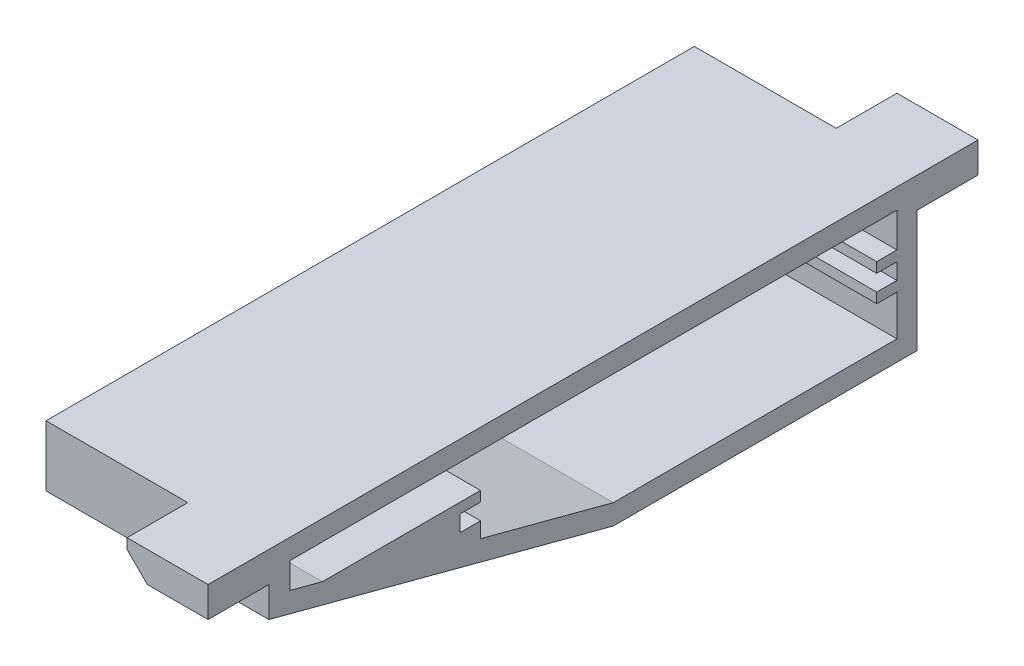
from build123d import *

# Parameters (mm, degrees)
SKETCH_1_W      = 22
SKETCH_1_H      = 15
EXTRUDE_1_DEPTH = 2
SKETCH_2_W      = 22
SKETCH_2_H      = 30
EXTRUDE_2_DEPTH = 2
EXTRUDE_3_DEPTH = 22
SKETCH_4_W      = 8
SKETCH_4_H      = 3
EXTRUDE_4_DEPTH = 6
SKETCH_5_W      = 8
SKETCH_5_H      = 3
EXTRUDE_5_DEPTH = 6
CHAMFER_1_SIZE  = 2
SKETCH_6_W      = 2
SKETCH_6_H      = 1
EXTRUDE_6_DEPTH = 22


with BuildPart() as part:
    # 草图1 → 凸台-拉伸1 (new body)
    with BuildSketch(Plane.XY):
        with Locations((11, 7.5)):
            Rectangle(SKETCH_1_W, SKETCH_1_H)
    extrude(amount=EXTRUDE_1_DEPTH)

    # 草图2 → 凸台-拉伸2 (add)
    with BuildSketch(Plane.XZ):
        with Locations((11, 15)):
            Rectangle(SKETCH_2_W, SKETCH_2_H)
    extrude(amount=-EXTRUDE_2_DEPTH)

    # 草图3 → 凸台-拉伸3 (add)
    with BuildSketch(Plane.ZY):
        Polygon((0, 15), (0, 13), (61.931971091, 13), (61.931971091, 10.452580583), (30, 2), (30, 0), (64, 9), (64, 15), align=None)
    extrude(amount=-EXTRUDE_3_DEPTH)

    # 草图4 → 凸台-拉伸4 (add)
    with BuildSketch(Plane.XY.offset(64)):
        with Locations((18, 13.5)):
            Rectangle(SKETCH_4_W, SKETCH_4_H)
    extrude(amount=EXTRUDE_4_DEPTH)

    # 草图5 → 凸台-拉伸5 (add)
    with BuildSketch(Plane(origin=(0, 0, 0), x_dir=(-1, 0, 0), z_dir=(0, 0, -1))):
        with Locations((-18, 13.5)):
            Rectangle(SKETCH_5_W, SKETCH_5_H)
    extrude(amount=EXTRUDE_5_DEPTH)

    # 倒角1
    chamfer_1_edges = [part.edges().sort_by_distance(p)[0] for p in [
        (14, 12, 67),
        (14, 12, -3),
    ]]
    chamfer(chamfer_1_edges, length=CHAMFER_1_SIZE)

    # 草图6 → 凸台-拉伸6 (add)
    with BuildSketch(Plane.ZY):
        with Locations((3, 6.5)):
            Rectangle(SKETCH_6_W, SKETCH_6_H)
        with Locations((3, 9.1)):
            Rectangle(SKETCH_6_W, SKETCH_6_H)
        Polygon((45.111111111, 7), (45.111111111, 8.6), (43.111111111, 8.6), (43.111111111, 9.6), (58.711111111, 9.6), (43.111111111, 5.470588235), (43.111111111, 7), align=None)
    extrude(amount=-EXTRUDE_6_DEPTH)


solid = part.part
